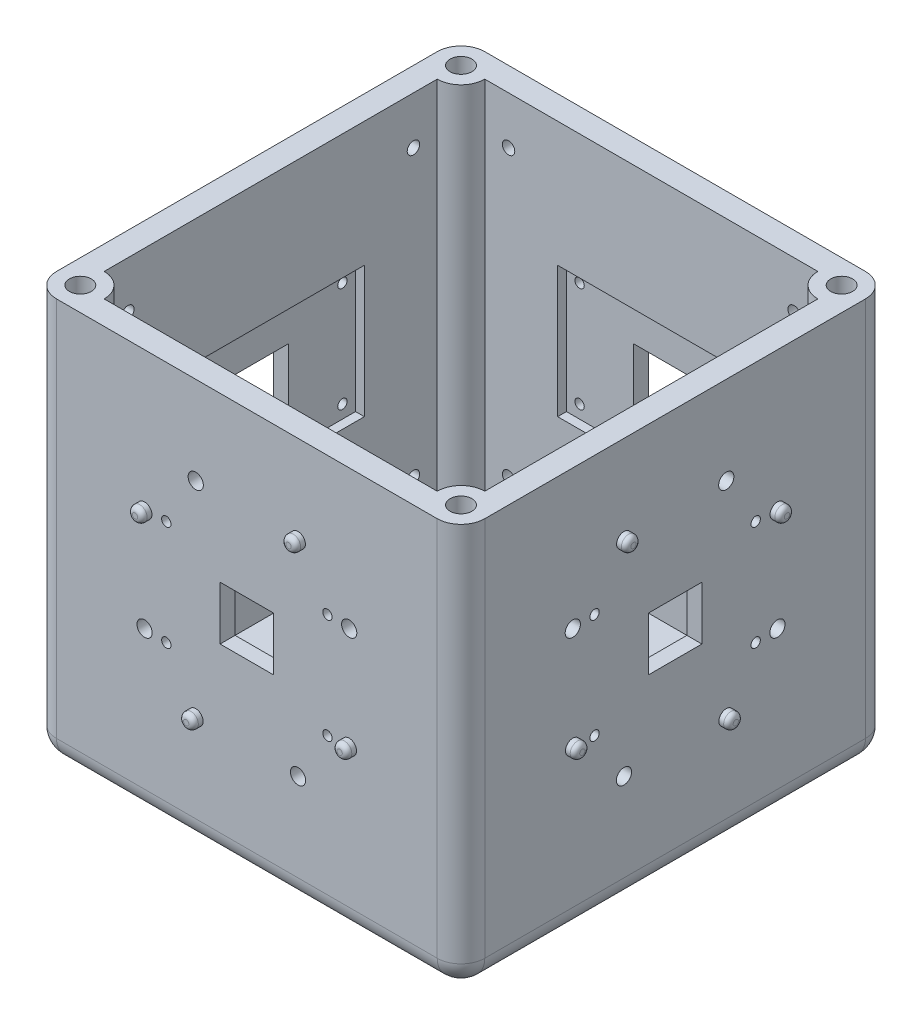
from build123d import *

# Parameters (mm, degrees)
SKETCH1_W                                  = 114.3
SKETCH1_H                                  = 114.3
BOSS_EXTRUDE1_DEPTH                        = 53.975
SHELL1_T                                   = -6.35
SKETCH3_W                                  = 6.35
SKETCH3_H                                  = 101.6
REVOLVE1_ANGLE                             = 90
MIRROR1_AT_THE_SECOND_PLANE_COPY_1_SKETC_W = 6.35
MIRROR1_AT_THE_SECOND_PLANE_COPY_1_SKETC_H = 101.6
MIRROR1_AT_THE_SECOND_PLANE_COPY_1_ANGLE   = 90
SKETCH16_W                                 = 14.2875
SKETCH16_H                                 = 14.2875
CUT_EXTRUDE1_DEPTH                         = 4
MIRROR4_AT_THE_SECOND_PLANE_COPY_1_SKETC_W = 14.2875
MIRROR4_AT_THE_SECOND_PLANE_COPY_1_SKETC_H = 14.2875
MIRROR4_AT_THE_SECOND_PLANE_COPY_1_DEPTH   = 4
FILLET1_R                                  = 6.35
SKETCH22_R                                 = 2.92
CUT_EXTRUDE5_DEPTH                         = 5.007428571
MIRROR6_AT_THE_SECOND_PLANE_COPY_1_SKETC_R = 2.92
MIRROR6_AT_THE_SECOND_PLANE_COPY_1_DEPTH   = 5.007428571
SKETCH25_R                                 = 1.9685
BOSS_EXTRUDE2_DEPTH                        = 2.54
SKETCH25_3_R                               = 2.032
CUT_EXTRUDE6_DEPTH                         = 3.048
FILLET5_R                                  = 1.27
MIRROR14_AT_THE_SECOND_PLANE_COPY_1_SKET_R = 2.032
MIRROR14_AT_THE_SECOND_PLANE_COPY_1_DEPTH  = 3.048
SKETCH15_W                                 = 50
SKETCH15_H                                 = 35
CUT_EXTRUDE10_DEPTH                        = 2.35
CUT_EXTRUDE11_REACH                        = 143.872
MIRROR15_AT_THE_SECOND_PLANE_COPY_1_SKET_W = 50
MIRROR15_AT_THE_SECOND_PLANE_COPY_1_SKET_H = 35
MIRROR15_AT_THE_SECOND_PLANE_COPY_1_DEPTH  = 2.35
MIRROR15_AT_THE_SECOND_PLANE_COPY_2_REACH  = 143.872
CUT_EXTRUDE12_DEPTH                        = 3.302
MIRROR16_AT_THE_SECOND_PLANE_COPY_1_DEPTH  = 3.302


# Read off the part's stored shape, not the designer's step: Mirror13
with BuildPart() as part:
    # Sketch1 → Boss-Extrude1 (new, symmetric)
    with BuildSketch(Plane(origin=(0, 0, 0), x_dir=(1, 0, 0), z_dir=(0, 1, 0))):
        Rectangle(SKETCH1_W, SKETCH1_H)
    extrude(amount=BOSS_EXTRUDE1_DEPTH, both=True)

    # Shell1
    shell1_openings = [part.faces().sort_by_distance(p)[0] for p in [
        (0, 53.975, 0),
    ]]
    offset(amount=SHELL1_T, openings=shell1_openings, kind=Kind.INTERSECTION)

    # Sketch3 → Revolve1 (revolve)
    with BuildSketch(Plane(origin=(-50.8, 0, 0), x_dir=(0, 0, -1), z_dir=(1, 0, 0))):
        with Locations((-47.625, 3.175)):
            Rectangle(SKETCH3_W, SKETCH3_H)
    revolve1 = revolve(axis=Axis((-50.8, 53.975, 50.8), (0, -1, 0)), revolution_arc=REVOLVE1_ANGLE)

    # Mirror1: Revolve1 across plane
    add(revolve1.mirror(Plane(origin=(0, 0, 0), x_dir=(0, 0, 1), z_dir=(1, 0, 0))))

    # Mirror1 at the second plane: Revolve1 across plane
    add(revolve1.mirror(Plane.XY))

    # Mirror1 at the second plane copy 1 sketc → Mirror1 at the second plane copy 1 (revolve)
    with BuildSketch(Plane.ZY.offset(-50.8)):
        with Locations((-47.625, 3.175)):
            Rectangle(MIRROR1_AT_THE_SECOND_PLANE_COPY_1_SKETC_W, MIRROR1_AT_THE_SECOND_PLANE_COPY_1_SKETC_H)
    revolve(axis=Axis((50.8, 53.975, -50.8), (0, -1, 0)), revolution_arc=MIRROR1_AT_THE_SECOND_PLANE_COPY_1_ANGLE)

    # Sketch16 → Cut-Extrude1 (cut)
    with BuildSketch(Plane.ZY.offset(57.15)):
        with Locations((0, 3.175)):
            Rectangle(SKETCH16_W, SKETCH16_H)
    cut_extrude1 = extrude(amount=-CUT_EXTRUDE1_DEPTH, mode=Mode.SUBTRACT)

    # Mirror4: Cut-Extrude1 across plane
    add(cut_extrude1.mirror(Plane(origin=(0, 0, 0), x_dir=(0.7071067811865465, 0, 0.7071067811865486), z_dir=(-0.7071067811865488, 0, 0.7071067811865464))), mode=Mode.SUBTRACT)

    # Mirror4 at the second plane: Cut-Extrude1 across plane
    add(cut_extrude1.mirror(Plane(origin=(0, 0, 0), x_dir=(-0.7071067811865465, 0, 0.7071067811865486), z_dir=(0.7071067811865488, 0, 0.7071067811865464))), mode=Mode.SUBTRACT)

    # Mirror4 at the second plane copy 1 sketc → Mirror4 at the second plane copy 1 (cut)
    with BuildSketch(Plane(origin=(57.15, 0, 0), x_dir=(0, 0, -1), z_dir=(1, 0, 0))):
        with Locations((0, 3.175)):
            Rectangle(MIRROR4_AT_THE_SECOND_PLANE_COPY_1_SKETC_W, MIRROR4_AT_THE_SECOND_PLANE_COPY_1_SKETC_H)
    extrude(amount=-MIRROR4_AT_THE_SECOND_PLANE_COPY_1_DEPTH, mode=Mode.SUBTRACT)

    # Fillet1
    fillet1_edges = [part.edges().sort_by_distance(p)[0] for p in [
        (0, -53.975, -57.15),
        (57.15, -53.975, 0),
        (0, -53.975, 57.15),
        (-57.15, -53.975, 0),
        (-57.15, 0, -57.15),
        (57.15, 0, -57.15),
        (57.15, 0, 57.15),
        (-57.15, 0, 57.15),
    ]]
    fillet(fillet1_edges, radius=FILLET1_R)

    # Sketch22 → Cut-Extrude5 (cut)
    with BuildSketch(Plane(origin=(0, 53.975, 0), x_dir=(1, 0, 0), z_dir=(0, 1, 0))):
        with Locations(Location((-50.8, -50.8, 0), (0, 0, 270))):
            Circle(SKETCH22_R)
    cut_extrude5 = extrude(amount=-CUT_EXTRUDE5_DEPTH, mode=Mode.SUBTRACT)

    # Mirror6: Cut-Extrude5 across plane
    add(cut_extrude5.mirror(Plane.XY), mode=Mode.SUBTRACT)

    # Mirror6 at the second plane: Cut-Extrude5 across plane
    add(cut_extrude5.mirror(Plane(origin=(0, 0, 0), x_dir=(0, 0, 1), z_dir=(1, 0, 0))), mode=Mode.SUBTRACT)

    # Mirror6 at the second plane copy 1 sketc → Mirror6 at the second plane copy 1 (cut)
    with BuildSketch(Plane(origin=(0, 53.975, 0), x_dir=(-1, 0, 0), z_dir=(0, 1, 0))):
        with Locations(Location((-50.8, -50.8, 0), (0, 0, 270))):
            Circle(MIRROR6_AT_THE_SECOND_PLANE_COPY_1_SKETC_R)
    extrude(amount=-MIRROR6_AT_THE_SECOND_PLANE_COPY_1_DEPTH, mode=Mode.SUBTRACT)

    # Sketch25 → Boss-Extrude2 (add)
    with BuildSketch(Plane.XY.offset(57.15)):
        with Locations(Location((-27.305, 16.8275, 0), (0, 0, 180))):
            Circle(SKETCH25_R)
        with Locations(Location((13.6525, 30.48, 0), (0, 0, 180))):
            Circle(SKETCH25_R)
        with Locations(Location((27.305, -10.4775, 0), (0, 0, 180))):
            Circle(SKETCH25_R)
        with Locations(Location((-13.6525, -24.13, 0), (0, 0, 180))):
            Circle(SKETCH25_R)
    extrude(amount=BOSS_EXTRUDE2_DEPTH)

    # Sketch25<3> → Cut-Extrude6 (cut)
    with BuildSketch(Plane.XY.offset(57.15)):
        with Locations((-27.305, -10.4775)):
            Circle(SKETCH25_3_R)
        with Locations((-13.6525, 30.48)):
            Circle(SKETCH25_3_R)
        with Locations((27.305, 16.8275)):
            Circle(SKETCH25_3_R)
        with Locations((13.6525, -24.13)):
            Circle(SKETCH25_3_R)
    cut_extrude6 = extrude(amount=-CUT_EXTRUDE6_DEPTH, mode=Mode.SUBTRACT)

    # Fillet5
    fillet5_edges = [part.edges().sort_by_distance(p)[0] for p in [
        (15.621, 30.48, 59.69),
        (29.2735, -10.4775, 59.69),
        (-11.684, -24.13, 59.69),
        (-25.3365, 16.8275, 59.69),
    ]]
    fillet(fillet5_edges, radius=FILLET5_R)

    # Mirror13 outline → Mirror13 (revolve)
    with BuildSketch(Plane(origin=(0, -24.13, 13.6525), x_dir=(0, 1, 0), z_dir=(0, 0, -1))):
        with BuildLine():
            ThreePointArc((0.6985, -59.69), (1.596525612, -59.318025612), (1.9685, -58.42))
            Line((1.9685, -58.42), (1.9685, -57.15))
            Line((1.9685, -57.15), (0, -57.15))
            Line((0, -57.15), (0, -59.69))
            Line((0, -59.69), (0.6985, -59.69))
        make_face()
    revolve(axis=Axis((0, -24.13, 13.6525), (1, 0, 0)))

    # Mirror13 2 outline → Mirror13 2 (revolve)
    with BuildSketch(Plane(origin=(0, -10.4775, -27.305), x_dir=(0, 1, 0), z_dir=(0, 0, -1))):
        with BuildLine():
            Line((0, -57.15), (0, -59.69))
            Line((0, -59.69), (0.6985, -59.69))
            ThreePointArc((0.6985, -59.69), (1.596525612, -59.318025612), (1.9685, -58.42))
            Line((1.9685, -58.42), (1.9685, -57.15))
            Line((1.9685, -57.15), (0, -57.15))
        make_face()
    revolve(axis=Axis((0, -10.4775, -27.305), (1, 0, 0)))

    # Mirror13 3 outline → Mirror13 3 (revolve)
    with BuildSketch(Plane(origin=(0, 30.48, -13.6525), x_dir=(0, 1, 0), z_dir=(0, 0, -1))):
        with BuildLine():
            Line((0, -57.15), (0, -59.69))
            Line((0, -59.69), (0.6985, -59.69))
            ThreePointArc((0.6985, -59.69), (1.596525612, -59.318025612), (1.9685, -58.42))
            Line((1.9685, -58.42), (1.9685, -57.15))
            Line((1.9685, -57.15), (0, -57.15))
        make_face()
    revolve(axis=Axis((0, 30.48, -13.6525), (1, 0, 0)))

    # Mirror13 4 outline → Mirror13 4 (revolve)
    with BuildSketch(Plane(origin=(0, 16.8275, 27.305), x_dir=(0, 1, 0), z_dir=(0, 0, -1))):
        with BuildLine():
            Line((0, -57.15), (0, -59.69))
            Line((0, -59.69), (0.6985, -59.69))
            ThreePointArc((0.6985, -59.69), (1.596525612, -59.318025612), (1.9685, -58.42))
            Line((1.9685, -58.42), (1.9685, -57.15))
            Line((1.9685, -57.15), (0, -57.15))
        make_face()
    revolve(axis=Axis((0, 16.8275, 27.305), (1, 0, 0)))

    # Mirror13 5 outline → Mirror13 5 (revolve)
    with BuildSketch(Plane(origin=(0, -24.13, -13.6525), x_dir=(0, 1, 0), z_dir=(0, 0, -1))):
        with BuildLine():
            Line((1.9685, 57.15), (1.9685, 58.42))
            ThreePointArc((1.9685, 58.42), (1.596525612, 59.318025612), (0.6985, 59.69))
            Line((0.6985, 59.69), (0, 59.69))
            Line((0, 59.69), (0, 57.15))
            Line((0, 57.15), (1.9685, 57.15))
        make_face()
    revolve(axis=Axis((0, -24.13, -13.6525), (1, 0, 0)))

    # Mirror13 6 outline → Mirror13 6 (revolve)
    with BuildSketch(Plane(origin=(0, -10.4775, 27.305), x_dir=(0, 1, 0), z_dir=(0, 0, -1))):
        with BuildLine():
            Line((0.6985, 59.69), (0, 59.69))
            Line((0, 59.69), (0, 57.15))
            Line((0, 57.15), (1.9685, 57.15))
            Line((1.9685, 57.15), (1.9685, 58.42))
            ThreePointArc((1.9685, 58.42), (1.596525612, 59.318025612), (0.6985, 59.69))
        make_face()
    revolve(axis=Axis((0, -10.4775, 27.305), (1, 0, 0)))

    # Mirror13 7 outline → Mirror13 7 (revolve)
    with BuildSketch(Plane(origin=(0, 30.48, 13.6525), x_dir=(0, 1, 0), z_dir=(0, 0, -1))):
        with BuildLine():
            Line((0.6985, 59.69), (0, 59.69))
            Line((0, 59.69), (0, 57.15))
            Line((0, 57.15), (1.9685, 57.15))
            Line((1.9685, 57.15), (1.9685, 58.42))
            ThreePointArc((1.9685, 58.42), (1.596525612, 59.318025612), (0.6985, 59.69))
        make_face()
    revolve(axis=Axis((0, 30.48, 13.6525), (1, 0, 0)))

    # Mirror13 8 outline → Mirror13 8 (revolve)
    with BuildSketch(Plane(origin=(0, 16.8275, -27.305), x_dir=(0, 1, 0), z_dir=(0, 0, -1))):
        with BuildLine():
            Line((0.6985, 59.69), (0, 59.69))
            Line((0, 59.69), (0, 57.15))
            Line((0, 57.15), (1.9685, 57.15))
            Line((1.9685, 57.15), (1.9685, 58.42))
            ThreePointArc((1.9685, 58.42), (1.596525612, 59.318025612), (0.6985, 59.69))
        make_face()
    revolve(axis=Axis((0, 16.8275, -27.305), (1, 0, 0)))

    # Mirror13 9 outline → Mirror13 9 (revolve)
    with BuildSketch(Plane(origin=(13.6525, -24.13, 0), x_dir=(1, 0, 0), z_dir=(0, -1, 0))):
        with BuildLine():
            ThreePointArc((0.6985, -59.69), (1.596525612, -59.318025612), (1.9685, -58.42))
            Line((1.9685, -58.42), (1.9685, -57.15))
            Line((1.9685, -57.15), (0, -57.15))
            Line((0, -57.15), (0, -59.69))
            Line((0, -59.69), (0.6985, -59.69))
        make_face()
    revolve(axis=Axis((13.6525, -24.13, 0), (0, 0, 1)))

    # Mirror13 10 outline → Mirror13 10 (revolve)
    with BuildSketch(Plane(origin=(-27.305, -10.4775, 0), x_dir=(1, 0, 0), z_dir=(0, -1, 0))):
        with BuildLine():
            Line((0, -57.15), (0, -59.69))
            Line((0, -59.69), (0.6985, -59.69))
            ThreePointArc((0.6985, -59.69), (1.596525612, -59.318025612), (1.9685, -58.42))
            Line((1.9685, -58.42), (1.9685, -57.15))
            Line((1.9685, -57.15), (0, -57.15))
        make_face()
    revolve(axis=Axis((-27.305, -10.4775, 0), (0, 0, 1)))

    # Mirror13 11 outline → Mirror13 11 (revolve)
    with BuildSketch(Plane(origin=(-13.6525, 30.48, 0), x_dir=(1, 0, 0), z_dir=(0, -1, 0))):
        with BuildLine():
            Line((0, -57.15), (0, -59.69))
            Line((0, -59.69), (0.6985, -59.69))
            ThreePointArc((0.6985, -59.69), (1.596525612, -59.318025612), (1.9685, -58.42))
            Line((1.9685, -58.42), (1.9685, -57.15))
            Line((1.9685, -57.15), (0, -57.15))
        make_face()
    revolve(axis=Axis((-13.6525, 30.48, 0), (0, 0, 1)))

    # Mirror13 12 outline → Mirror13 12 (revolve)
    with BuildSketch(Plane(origin=(27.305, 16.8275, 0), x_dir=(1, 0, 0), z_dir=(0, -1, 0))):
        with BuildLine():
            Line((0, -57.15), (0, -59.69))
            Line((0, -59.69), (0.6985, -59.69))
            ThreePointArc((0.6985, -59.69), (1.596525612, -59.318025612), (1.9685, -58.42))
            Line((1.9685, -58.42), (1.9685, -57.15))
            Line((1.9685, -57.15), (0, -57.15))
        make_face()
    revolve(axis=Axis((27.305, 16.8275, 0), (0, 0, 1)))

    # Mirror14: Cut-Extrude6 across plane
    add(cut_extrude6.mirror(Plane(origin=(0, 0, 0), x_dir=(0.7071067811865465, 0, 0.7071067811865486), z_dir=(-0.7071067811865488, 0, 0.7071067811865464))), mode=Mode.SUBTRACT)

    # Mirror14 at the second plane: Cut-Extrude6 across plane
    add(cut_extrude6.mirror(Plane(origin=(0, 0, 0), x_dir=(-0.7071067811865465, 0, 0.7071067811865486), z_dir=(0.7071067811865488, 0, 0.7071067811865464))), mode=Mode.SUBTRACT)

    # Mirror14 at the second plane copy 1 sket → Mirror14 at the second plane copy 1 (cut)
    with BuildSketch(Plane(origin=(0, 0, -57.15), x_dir=(-1, 0, 0), z_dir=(0, 0, -1))):
        with Locations((-27.305, -10.4775)):
            Circle(MIRROR14_AT_THE_SECOND_PLANE_COPY_1_SKET_R)
        with Locations((-13.6525, 30.48)):
            Circle(MIRROR14_AT_THE_SECOND_PLANE_COPY_1_SKET_R)
        with Locations((27.305, 16.8275)):
            Circle(MIRROR14_AT_THE_SECOND_PLANE_COPY_1_SKET_R)
        with Locations((13.6525, -24.13)):
            Circle(MIRROR14_AT_THE_SECOND_PLANE_COPY_1_SKET_R)
    extrude(amount=-MIRROR14_AT_THE_SECOND_PLANE_COPY_1_DEPTH, mode=Mode.SUBTRACT)

    # Sketch15 → Cut-Extrude10 (cut)
    with BuildSketch(Plane(origin=(-50.8, 0, 0), x_dir=(0, 0, -1), z_dir=(1, 0, 0))):
        with Locations((0, 3.175)):
            Rectangle(SKETCH15_W, SKETCH15_H)
    cut_extrude10 = extrude(amount=-CUT_EXTRUDE10_DEPTH, mode=Mode.SUBTRACT)

    # Sketch34 → Cut-Extrude11 (cut, up to next)
    with BuildSketch(Plane.ZY.offset(57.15), mode=Mode.PRIVATE) as cut_extrude11_sk1:
        with BuildLine():
            Line((-21.5, 15.925), (-21.5, 17.175))
            Line((-21.5, 17.175), (-20.25, 17.175))
            ThreePointArc((-20.25, 17.175), (-22.383883476, 18.058883476), (-21.5, 15.925))
        make_face()
    cut_extrude11_tool1 = extrude(cut_extrude11_sk1.sketch, amount=-CUT_EXTRUDE11_REACH, mode=Mode.PRIVATE) & part.part
    # Sketch34 → Cut-Extrude11 (cut, up to next)
    with BuildSketch(Plane.ZY.offset(57.15), mode=Mode.PRIVATE) as cut_extrude11_sk2:
        with BuildLine():
            Line((-20.25, 17.175), (-21.5, 17.175))
            Line((-21.5, 17.175), (-21.5, 15.925))
            ThreePointArc((-21.5, 15.925), (-20.616116524, 16.291116524), (-20.25, 17.175))
        make_face()
    cut_extrude11_tool2 = extrude(cut_extrude11_sk2.sketch, amount=-CUT_EXTRUDE11_REACH, mode=Mode.PRIVATE) & part.part
    # Sketch34 → Cut-Extrude11 (cut, up to next)
    with BuildSketch(Plane.ZY.offset(57.15), mode=Mode.PRIVATE) as cut_extrude11_sk3:
        with BuildLine():
            Line((-21.5, 15.925), (-21.5, 17.175))
            Line((-21.5, 17.175), (-20.25, 17.175))
            ThreePointArc((-20.25, 17.175), (-22.383883476, 18.058883476), (-21.5, 15.925))
        make_face()
    cut_extrude11_tool3 = extrude(cut_extrude11_sk3.sketch, amount=-CUT_EXTRUDE11_REACH, mode=Mode.PRIVATE) & part.part
    # Sketch34 → Cut-Extrude11 (cut, up to next)
    with BuildSketch(Plane.ZY.offset(57.15), mode=Mode.PRIVATE) as cut_extrude11_sk4:
        with BuildLine():
            Line((-20.25, 17.175), (-21.5, 17.175))
            Line((-21.5, 17.175), (-21.5, 15.925))
            ThreePointArc((-21.5, 15.925), (-20.616116524, 16.291116524), (-20.25, 17.175))
        make_face()
    cut_extrude11_tool4 = extrude(cut_extrude11_sk4.sketch, amount=-CUT_EXTRUDE11_REACH, mode=Mode.PRIVATE) & part.part
    # Sketch34 → Cut-Extrude11 (cut, up to next)
    with BuildSketch(Plane.ZY.offset(57.15), mode=Mode.PRIVATE) as cut_extrude11_sk5:
        with BuildLine():
            ThreePointArc((22.75, 17.175), (21.5, 18.425), (20.25, 17.175))
            Line((20.25, 17.175), (21.5, 17.175))
            Line((21.5, 17.175), (21.5, 15.925))
            ThreePointArc((21.5, 15.925), (22.383883476, 16.291116524), (22.75, 17.175))
        make_face()
    cut_extrude11_tool5 = extrude(cut_extrude11_sk5.sketch, amount=-CUT_EXTRUDE11_REACH, mode=Mode.PRIVATE) & part.part
    # Sketch34 → Cut-Extrude11 (cut, up to next)
    with BuildSketch(Plane.ZY.offset(57.15), mode=Mode.PRIVATE) as cut_extrude11_sk6:
        with BuildLine():
            Line((21.5, 17.175), (20.25, 17.175))
            ThreePointArc((20.25, 17.175), (20.616116524, 16.291116524), (21.5, 15.925))
            Line((21.5, 15.925), (21.5, 17.175))
        make_face()
    cut_extrude11_tool6 = extrude(cut_extrude11_sk6.sketch, amount=-CUT_EXTRUDE11_REACH, mode=Mode.PRIVATE) & part.part
    # Sketch34 → Cut-Extrude11 (cut, up to next)
    with BuildSketch(Plane.ZY.offset(57.15), mode=Mode.PRIVATE) as cut_extrude11_sk7:
        with BuildLine():
            ThreePointArc((22.75, 17.175), (21.5, 18.425), (20.25, 17.175))
            Line((20.25, 17.175), (21.5, 17.175))
            Line((21.5, 17.175), (21.5, 15.925))
            ThreePointArc((21.5, 15.925), (22.383883476, 16.291116524), (22.75, 17.175))
        make_face()
    cut_extrude11_tool7 = extrude(cut_extrude11_sk7.sketch, amount=-CUT_EXTRUDE11_REACH, mode=Mode.PRIVATE) & part.part
    # Sketch34 → Cut-Extrude11 (cut, up to next)
    with BuildSketch(Plane.ZY.offset(57.15), mode=Mode.PRIVATE) as cut_extrude11_sk8:
        with BuildLine():
            Line((21.5, 17.175), (20.25, 17.175))
            ThreePointArc((20.25, 17.175), (20.616116524, 16.291116524), (21.5, 15.925))
            Line((21.5, 15.925), (21.5, 17.175))
        make_face()
    cut_extrude11_tool8 = extrude(cut_extrude11_sk8.sketch, amount=-CUT_EXTRUDE11_REACH, mode=Mode.PRIVATE) & part.part
    # Sketch34 → Cut-Extrude11 (cut, up to next)
    with BuildSketch(Plane.ZY.offset(57.15), mode=Mode.PRIVATE) as cut_extrude11_sk9:
        with BuildLine():
            ThreePointArc((22.75, -10.825), (22.383883476, -9.941116524), (21.5, -9.575))
            Line((21.5, -9.575), (21.5, -10.825))
            Line((21.5, -10.825), (20.25, -10.825))
            ThreePointArc((20.25, -10.825), (21.5, -12.075), (22.75, -10.825))
        make_face()
    cut_extrude11_tool9 = extrude(cut_extrude11_sk9.sketch, amount=-CUT_EXTRUDE11_REACH, mode=Mode.PRIVATE) & part.part
    # Sketch34 → Cut-Extrude11 (cut, up to next)
    with BuildSketch(Plane.ZY.offset(57.15), mode=Mode.PRIVATE) as cut_extrude11_sk10:
        with BuildLine():
            Line((21.5, -10.825), (21.5, -9.575))
            ThreePointArc((21.5, -9.575), (20.616116524, -9.941116524), (20.25, -10.825))
            Line((20.25, -10.825), (21.5, -10.825))
        make_face()
    cut_extrude11_tool10 = extrude(cut_extrude11_sk10.sketch, amount=-CUT_EXTRUDE11_REACH, mode=Mode.PRIVATE) & part.part
    # Sketch34 → Cut-Extrude11 (cut, up to next)
    with BuildSketch(Plane.ZY.offset(57.15), mode=Mode.PRIVATE) as cut_extrude11_sk11:
        with BuildLine():
            ThreePointArc((22.75, -10.825), (22.383883476, -9.941116524), (21.5, -9.575))
            Line((21.5, -9.575), (21.5, -10.825))
            Line((21.5, -10.825), (20.25, -10.825))
            ThreePointArc((20.25, -10.825), (21.5, -12.075), (22.75, -10.825))
        make_face()
    cut_extrude11_tool11 = extrude(cut_extrude11_sk11.sketch, amount=-CUT_EXTRUDE11_REACH, mode=Mode.PRIVATE) & part.part
    # Sketch34 → Cut-Extrude11 (cut, up to next)
    with BuildSketch(Plane.ZY.offset(57.15), mode=Mode.PRIVATE) as cut_extrude11_sk12:
        with BuildLine():
            Line((21.5, -10.825), (21.5, -9.575))
            ThreePointArc((21.5, -9.575), (20.616116524, -9.941116524), (20.25, -10.825))
            Line((20.25, -10.825), (21.5, -10.825))
        make_face()
    cut_extrude11_tool12 = extrude(cut_extrude11_sk12.sketch, amount=-CUT_EXTRUDE11_REACH, mode=Mode.PRIVATE) & part.part
    # Sketch34 → Cut-Extrude11 (cut, up to next)
    with BuildSketch(Plane.ZY.offset(57.15), mode=Mode.PRIVATE) as cut_extrude11_sk13:
        with BuildLine():
            ThreePointArc((-20.25, -10.825), (-20.616116524, -9.941116524), (-21.5, -9.575))
            Line((-21.5, -9.575), (-21.5, -10.825))
            Line((-21.5, -10.825), (-20.25, -10.825))
        make_face()
    cut_extrude11_tool13 = extrude(cut_extrude11_sk13.sketch, amount=-CUT_EXTRUDE11_REACH, mode=Mode.PRIVATE) & part.part
    # Sketch34 → Cut-Extrude11 (cut, up to next)
    with BuildSketch(Plane.ZY.offset(57.15), mode=Mode.PRIVATE) as cut_extrude11_sk14:
        with BuildLine():
            Line((-21.5, -10.825), (-21.5, -9.575))
            ThreePointArc((-21.5, -9.575), (-22.383883476, -11.708883476), (-20.25, -10.825))
            Line((-20.25, -10.825), (-21.5, -10.825))
        make_face()
    cut_extrude11_tool14 = extrude(cut_extrude11_sk14.sketch, amount=-CUT_EXTRUDE11_REACH, mode=Mode.PRIVATE) & part.part
    # Sketch34 → Cut-Extrude11 (cut, up to next)
    with BuildSketch(Plane.ZY.offset(57.15), mode=Mode.PRIVATE) as cut_extrude11_sk15:
        with BuildLine():
            ThreePointArc((-20.25, -10.825), (-20.616116524, -9.941116524), (-21.5, -9.575))
            Line((-21.5, -9.575), (-21.5, -10.825))
            Line((-21.5, -10.825), (-20.25, -10.825))
        make_face()
    cut_extrude11_tool15 = extrude(cut_extrude11_sk15.sketch, amount=-CUT_EXTRUDE11_REACH, mode=Mode.PRIVATE) & part.part
    # Sketch34 → Cut-Extrude11 (cut, up to next)
    with BuildSketch(Plane.ZY.offset(57.15), mode=Mode.PRIVATE) as cut_extrude11_sk16:
        with BuildLine():
            Line((-21.5, -10.825), (-21.5, -9.575))
            ThreePointArc((-21.5, -9.575), (-22.383883476, -11.708883476), (-20.25, -10.825))
            Line((-20.25, -10.825), (-21.5, -10.825))
        make_face()
    cut_extrude11_tool16 = extrude(cut_extrude11_sk16.sketch, amount=-CUT_EXTRUDE11_REACH, mode=Mode.PRIVATE) & part.part
    cut_extrude11_1 = cut_extrude11_tool1.solids().sort_by_distance((-57.15, 17.351839, -21.676839))[0]
    add(cut_extrude11_1, mode=Mode.SUBTRACT)
    cut_extrude11_2 = cut_extrude11_tool2.solids().sort_by_distance((-57.15, 16.644484, -20.969484))[0]
    add(cut_extrude11_2, mode=Mode.SUBTRACT)
    cut_extrude11_3 = cut_extrude11_tool3.solids().sort_by_distance((-57.15, 17.351839, -21.676839))[0]
    add(cut_extrude11_3, mode=Mode.SUBTRACT)
    cut_extrude11_4 = cut_extrude11_tool4.solids().sort_by_distance((-57.15, 16.644484, -20.969484))[0]
    add(cut_extrude11_4, mode=Mode.SUBTRACT)
    cut_extrude11_5 = cut_extrude11_tool5.solids().sort_by_distance((-57.15, 17.351839, 21.676839))[0]
    add(cut_extrude11_5, mode=Mode.SUBTRACT)
    cut_extrude11_6 = cut_extrude11_tool6.solids().sort_by_distance((-57.15, 16.644484, 20.969484))[0]
    add(cut_extrude11_6, mode=Mode.SUBTRACT)
    cut_extrude11_7 = cut_extrude11_tool7.solids().sort_by_distance((-57.15, 17.351839, 21.676839))[0]
    add(cut_extrude11_7, mode=Mode.SUBTRACT)
    cut_extrude11_8 = cut_extrude11_tool8.solids().sort_by_distance((-57.15, 16.644484, 20.969484))[0]
    add(cut_extrude11_8, mode=Mode.SUBTRACT)
    cut_extrude11_9 = cut_extrude11_tool9.solids().sort_by_distance((-57.15, -11.001839, 21.676839))[0]
    add(cut_extrude11_9, mode=Mode.SUBTRACT)
    cut_extrude11_10 = cut_extrude11_tool10.solids().sort_by_distance((-57.15, -10.294484, 20.969484))[0]
    add(cut_extrude11_10, mode=Mode.SUBTRACT)
    cut_extrude11_11 = cut_extrude11_tool11.solids().sort_by_distance((-57.15, -11.001839, 21.676839))[0]
    add(cut_extrude11_11, mode=Mode.SUBTRACT)
    cut_extrude11_12 = cut_extrude11_tool12.solids().sort_by_distance((-57.15, -10.294484, 20.969484))[0]
    add(cut_extrude11_12, mode=Mode.SUBTRACT)
    cut_extrude11_13 = cut_extrude11_tool13.solids().sort_by_distance((-57.15, -10.294484, -20.969484))[0]
    add(cut_extrude11_13, mode=Mode.SUBTRACT)
    cut_extrude11_14 = cut_extrude11_tool14.solids().sort_by_distance((-57.15, -11.001839, -21.676839))[0]
    add(cut_extrude11_14, mode=Mode.SUBTRACT)
    cut_extrude11_15 = cut_extrude11_tool15.solids().sort_by_distance((-57.15, -10.294484, -20.969484))[0]
    add(cut_extrude11_15, mode=Mode.SUBTRACT)
    cut_extrude11_16 = cut_extrude11_tool16.solids().sort_by_distance((-57.15, -11.001839, -21.676839))[0]
    add(cut_extrude11_16, mode=Mode.SUBTRACT)
    cut_extrude11 = cut_extrude11_1 + cut_extrude11_2 + cut_extrude11_3 + cut_extrude11_4 + cut_extrude11_5 + cut_extrude11_6 + cut_extrude11_7 + cut_extrude11_8 + cut_extrude11_9 + cut_extrude11_10 + cut_extrude11_11 + cut_extrude11_12 + cut_extrude11_13 + cut_extrude11_14 + cut_extrude11_15 + cut_extrude11_16  # Cut-Extrude11 as one shape, for the pattern or mirror that repeats it

    # Mirror15: Cut-Extrude10, Cut-Extrude11 across plane
    add(cut_extrude10.mirror(Plane(origin=(0, 0, 0), x_dir=(0.7071067811865465, 0, 0.7071067811865486), z_dir=(-0.7071067811865488, 0, 0.7071067811865464))), mode=Mode.SUBTRACT)
    add(cut_extrude11.mirror(Plane(origin=(0, 0, 0), x_dir=(0.7071067811865465, 0, 0.7071067811865486), z_dir=(-0.7071067811865488, 0, 0.7071067811865464))), mode=Mode.SUBTRACT)

    # Mirror15 at the second plane: Cut-Extrude10, Cut-Extrude11 across plane
    add(cut_extrude10.mirror(Plane(origin=(0, 0, 0), x_dir=(-0.7071067811865465, 0, 0.7071067811865486), z_dir=(0.7071067811865488, 0, 0.7071067811865464))), mode=Mode.SUBTRACT)
    add(cut_extrude11.mirror(Plane(origin=(0, 0, 0), x_dir=(-0.7071067811865465, 0, 0.7071067811865486), z_dir=(0.7071067811865488, 0, 0.7071067811865464))), mode=Mode.SUBTRACT)

    # Mirror15 at the second plane copy 1 sket → Mirror15 at the second plane copy 1 (cut)
    with BuildSketch(Plane.ZY.offset(-50.8)):
        with Locations((0, 3.175)):
            Rectangle(MIRROR15_AT_THE_SECOND_PLANE_COPY_1_SKET_W, MIRROR15_AT_THE_SECOND_PLANE_COPY_1_SKET_H)
    extrude(amount=-MIRROR15_AT_THE_SECOND_PLANE_COPY_1_DEPTH, mode=Mode.SUBTRACT)

    # Mirror15 at the second plane copy 2 sket → Mirror15 at the second plane copy 2 (cut, up to next)
    with BuildSketch(Plane(origin=(57.15, 0, 0), x_dir=(0, 0, -1), z_dir=(1, 0, 0)), mode=Mode.PRIVATE) as mirror15_at_the_second_plane_copy_2_sk1:
        with BuildLine():
            Line((-21.5, 15.925), (-21.5, 17.175))
            Line((-21.5, 17.175), (-20.25, 17.175))
            ThreePointArc((-20.25, 17.175), (-22.383883476, 18.058883476), (-21.5, 15.925))
        make_face()
    mirror15_at_the_second_plane_copy_2_tool1 = extrude(mirror15_at_the_second_plane_copy_2_sk1.sketch, amount=-MIRROR15_AT_THE_SECOND_PLANE_COPY_2_REACH, mode=Mode.PRIVATE) & part.part
    # Mirror15 at the second plane copy 2 sket → Mirror15 at the second plane copy 2 (cut, up to next)
    with BuildSketch(Plane(origin=(57.15, 0, 0), x_dir=(0, 0, -1), z_dir=(1, 0, 0)), mode=Mode.PRIVATE) as mirror15_at_the_second_plane_copy_2_sk2:
        with BuildLine():
            Line((-20.25, 17.175), (-21.5, 17.175))
            Line((-21.5, 17.175), (-21.5, 15.925))
            ThreePointArc((-21.5, 15.925), (-20.616116524, 16.291116524), (-20.25, 17.175))
        make_face()
    mirror15_at_the_second_plane_copy_2_tool2 = extrude(mirror15_at_the_second_plane_copy_2_sk2.sketch, amount=-MIRROR15_AT_THE_SECOND_PLANE_COPY_2_REACH, mode=Mode.PRIVATE) & part.part
    # Mirror15 at the second plane copy 2 sket → Mirror15 at the second plane copy 2 (cut, up to next)
    with BuildSketch(Plane(origin=(57.15, 0, 0), x_dir=(0, 0, -1), z_dir=(1, 0, 0)), mode=Mode.PRIVATE) as mirror15_at_the_second_plane_copy_2_sk3:
        with BuildLine():
            Line((-21.5, 15.925), (-21.5, 17.175))
            Line((-21.5, 17.175), (-20.25, 17.175))
            ThreePointArc((-20.25, 17.175), (-22.383883476, 18.058883476), (-21.5, 15.925))
        make_face()
    mirror15_at_the_second_plane_copy_2_tool3 = extrude(mirror15_at_the_second_plane_copy_2_sk3.sketch, amount=-MIRROR15_AT_THE_SECOND_PLANE_COPY_2_REACH, mode=Mode.PRIVATE) & part.part
    # Mirror15 at the second plane copy 2 sket → Mirror15 at the second plane copy 2 (cut, up to next)
    with BuildSketch(Plane(origin=(57.15, 0, 0), x_dir=(0, 0, -1), z_dir=(1, 0, 0)), mode=Mode.PRIVATE) as mirror15_at_the_second_plane_copy_2_sk4:
        with BuildLine():
            Line((-20.25, 17.175), (-21.5, 17.175))
            Line((-21.5, 17.175), (-21.5, 15.925))
            ThreePointArc((-21.5, 15.925), (-20.616116524, 16.291116524), (-20.25, 17.175))
        make_face()
    mirror15_at_the_second_plane_copy_2_tool4 = extrude(mirror15_at_the_second_plane_copy_2_sk4.sketch, amount=-MIRROR15_AT_THE_SECOND_PLANE_COPY_2_REACH, mode=Mode.PRIVATE) & part.part
    # Mirror15 at the second plane copy 2 sket → Mirror15 at the second plane copy 2 (cut, up to next)
    with BuildSketch(Plane(origin=(57.15, 0, 0), x_dir=(0, 0, -1), z_dir=(1, 0, 0)), mode=Mode.PRIVATE) as mirror15_at_the_second_plane_copy_2_sk5:
        with BuildLine():
            ThreePointArc((22.75, 17.175), (21.5, 18.425), (20.25, 17.175))
            Line((20.25, 17.175), (21.5, 17.175))
            Line((21.5, 17.175), (21.5, 15.925))
            ThreePointArc((21.5, 15.925), (22.383883476, 16.291116524), (22.75, 17.175))
        make_face()
    mirror15_at_the_second_plane_copy_2_tool5 = extrude(mirror15_at_the_second_plane_copy_2_sk5.sketch, amount=-MIRROR15_AT_THE_SECOND_PLANE_COPY_2_REACH, mode=Mode.PRIVATE) & part.part
    # Mirror15 at the second plane copy 2 sket → Mirror15 at the second plane copy 2 (cut, up to next)
    with BuildSketch(Plane(origin=(57.15, 0, 0), x_dir=(0, 0, -1), z_dir=(1, 0, 0)), mode=Mode.PRIVATE) as mirror15_at_the_second_plane_copy_2_sk6:
        with BuildLine():
            Line((21.5, 17.175), (20.25, 17.175))
            ThreePointArc((20.25, 17.175), (20.616116524, 16.291116524), (21.5, 15.925))
            Line((21.5, 15.925), (21.5, 17.175))
        make_face()
    mirror15_at_the_second_plane_copy_2_tool6 = extrude(mirror15_at_the_second_plane_copy_2_sk6.sketch, amount=-MIRROR15_AT_THE_SECOND_PLANE_COPY_2_REACH, mode=Mode.PRIVATE) & part.part
    # Mirror15 at the second plane copy 2 sket → Mirror15 at the second plane copy 2 (cut, up to next)
    with BuildSketch(Plane(origin=(57.15, 0, 0), x_dir=(0, 0, -1), z_dir=(1, 0, 0)), mode=Mode.PRIVATE) as mirror15_at_the_second_plane_copy_2_sk7:
        with BuildLine():
            ThreePointArc((22.75, 17.175), (21.5, 18.425), (20.25, 17.175))
            Line((20.25, 17.175), (21.5, 17.175))
            Line((21.5, 17.175), (21.5, 15.925))
            ThreePointArc((21.5, 15.925), (22.383883476, 16.291116524), (22.75, 17.175))
        make_face()
    mirror15_at_the_second_plane_copy_2_tool7 = extrude(mirror15_at_the_second_plane_copy_2_sk7.sketch, amount=-MIRROR15_AT_THE_SECOND_PLANE_COPY_2_REACH, mode=Mode.PRIVATE) & part.part
    # Mirror15 at the second plane copy 2 sket → Mirror15 at the second plane copy 2 (cut, up to next)
    with BuildSketch(Plane(origin=(57.15, 0, 0), x_dir=(0, 0, -1), z_dir=(1, 0, 0)), mode=Mode.PRIVATE) as mirror15_at_the_second_plane_copy_2_sk8:
        with BuildLine():
            Line((21.5, 17.175), (20.25, 17.175))
            ThreePointArc((20.25, 17.175), (20.616116524, 16.291116524), (21.5, 15.925))
            Line((21.5, 15.925), (21.5, 17.175))
        make_face()
    mirror15_at_the_second_plane_copy_2_tool8 = extrude(mirror15_at_the_second_plane_copy_2_sk8.sketch, amount=-MIRROR15_AT_THE_SECOND_PLANE_COPY_2_REACH, mode=Mode.PRIVATE) & part.part
    # Mirror15 at the second plane copy 2 sket → Mirror15 at the second plane copy 2 (cut, up to next)
    with BuildSketch(Plane(origin=(57.15, 0, 0), x_dir=(0, 0, -1), z_dir=(1, 0, 0)), mode=Mode.PRIVATE) as mirror15_at_the_second_plane_copy_2_sk9:
        with BuildLine():
            ThreePointArc((22.75, -10.825), (22.383883476, -9.941116524), (21.5, -9.575))
            Line((21.5, -9.575), (21.5, -10.825))
            Line((21.5, -10.825), (20.25, -10.825))
            ThreePointArc((20.25, -10.825), (21.5, -12.075), (22.75, -10.825))
        make_face()
    mirror15_at_the_second_plane_copy_2_tool9 = extrude(mirror15_at_the_second_plane_copy_2_sk9.sketch, amount=-MIRROR15_AT_THE_SECOND_PLANE_COPY_2_REACH, mode=Mode.PRIVATE) & part.part
    # Mirror15 at the second plane copy 2 sket → Mirror15 at the second plane copy 2 (cut, up to next)
    with BuildSketch(Plane(origin=(57.15, 0, 0), x_dir=(0, 0, -1), z_dir=(1, 0, 0)), mode=Mode.PRIVATE) as mirror15_at_the_second_plane_copy_2_sk10:
        with BuildLine():
            Line((21.5, -10.825), (21.5, -9.575))
            ThreePointArc((21.5, -9.575), (20.616116524, -9.941116524), (20.25, -10.825))
            Line((20.25, -10.825), (21.5, -10.825))
        make_face()
    mirror15_at_the_second_plane_copy_2_tool10 = extrude(mirror15_at_the_second_plane_copy_2_sk10.sketch, amount=-MIRROR15_AT_THE_SECOND_PLANE_COPY_2_REACH, mode=Mode.PRIVATE) & part.part
    # Mirror15 at the second plane copy 2 sket → Mirror15 at the second plane copy 2 (cut, up to next)
    with BuildSketch(Plane(origin=(57.15, 0, 0), x_dir=(0, 0, -1), z_dir=(1, 0, 0)), mode=Mode.PRIVATE) as mirror15_at_the_second_plane_copy_2_sk11:
        with BuildLine():
            ThreePointArc((22.75, -10.825), (22.383883476, -9.941116524), (21.5, -9.575))
            Line((21.5, -9.575), (21.5, -10.825))
            Line((21.5, -10.825), (20.25, -10.825))
            ThreePointArc((20.25, -10.825), (21.5, -12.075), (22.75, -10.825))
        make_face()
    mirror15_at_the_second_plane_copy_2_tool11 = extrude(mirror15_at_the_second_plane_copy_2_sk11.sketch, amount=-MIRROR15_AT_THE_SECOND_PLANE_COPY_2_REACH, mode=Mode.PRIVATE) & part.part
    # Mirror15 at the second plane copy 2 sket → Mirror15 at the second plane copy 2 (cut, up to next)
    with BuildSketch(Plane(origin=(57.15, 0, 0), x_dir=(0, 0, -1), z_dir=(1, 0, 0)), mode=Mode.PRIVATE) as mirror15_at_the_second_plane_copy_2_sk12:
        with BuildLine():
            Line((21.5, -10.825), (21.5, -9.575))
            ThreePointArc((21.5, -9.575), (20.616116524, -9.941116524), (20.25, -10.825))
            Line((20.25, -10.825), (21.5, -10.825))
        make_face()
    mirror15_at_the_second_plane_copy_2_tool12 = extrude(mirror15_at_the_second_plane_copy_2_sk12.sketch, amount=-MIRROR15_AT_THE_SECOND_PLANE_COPY_2_REACH, mode=Mode.PRIVATE) & part.part
    # Mirror15 at the second plane copy 2 sket → Mirror15 at the second plane copy 2 (cut, up to next)
    with BuildSketch(Plane(origin=(57.15, 0, 0), x_dir=(0, 0, -1), z_dir=(1, 0, 0)), mode=Mode.PRIVATE) as mirror15_at_the_second_plane_copy_2_sk13:
        with BuildLine():
            ThreePointArc((-20.25, -10.825), (-20.616116524, -9.941116524), (-21.5, -9.575))
            Line((-21.5, -9.575), (-21.5, -10.825))
            Line((-21.5, -10.825), (-20.25, -10.825))
        make_face()
    mirror15_at_the_second_plane_copy_2_tool13 = extrude(mirror15_at_the_second_plane_copy_2_sk13.sketch, amount=-MIRROR15_AT_THE_SECOND_PLANE_COPY_2_REACH, mode=Mode.PRIVATE) & part.part
    # Mirror15 at the second plane copy 2 sket → Mirror15 at the second plane copy 2 (cut, up to next)
    with BuildSketch(Plane(origin=(57.15, 0, 0), x_dir=(0, 0, -1), z_dir=(1, 0, 0)), mode=Mode.PRIVATE) as mirror15_at_the_second_plane_copy_2_sk14:
        with BuildLine():
            Line((-21.5, -10.825), (-21.5, -9.575))
            ThreePointArc((-21.5, -9.575), (-22.383883476, -11.708883476), (-20.25, -10.825))
            Line((-20.25, -10.825), (-21.5, -10.825))
        make_face()
    mirror15_at_the_second_plane_copy_2_tool14 = extrude(mirror15_at_the_second_plane_copy_2_sk14.sketch, amount=-MIRROR15_AT_THE_SECOND_PLANE_COPY_2_REACH, mode=Mode.PRIVATE) & part.part
    # Mirror15 at the second plane copy 2 sket → Mirror15 at the second plane copy 2 (cut, up to next)
    with BuildSketch(Plane(origin=(57.15, 0, 0), x_dir=(0, 0, -1), z_dir=(1, 0, 0)), mode=Mode.PRIVATE) as mirror15_at_the_second_plane_copy_2_sk15:
        with BuildLine():
            ThreePointArc((-20.25, -10.825), (-20.616116524, -9.941116524), (-21.5, -9.575))
            Line((-21.5, -9.575), (-21.5, -10.825))
            Line((-21.5, -10.825), (-20.25, -10.825))
        make_face()
    mirror15_at_the_second_plane_copy_2_tool15 = extrude(mirror15_at_the_second_plane_copy_2_sk15.sketch, amount=-MIRROR15_AT_THE_SECOND_PLANE_COPY_2_REACH, mode=Mode.PRIVATE) & part.part
    # Mirror15 at the second plane copy 2 sket → Mirror15 at the second plane copy 2 (cut, up to next)
    with BuildSketch(Plane(origin=(57.15, 0, 0), x_dir=(0, 0, -1), z_dir=(1, 0, 0)), mode=Mode.PRIVATE) as mirror15_at_the_second_plane_copy_2_sk16:
        with BuildLine():
            Line((-21.5, -10.825), (-21.5, -9.575))
            ThreePointArc((-21.5, -9.575), (-22.383883476, -11.708883476), (-20.25, -10.825))
            Line((-20.25, -10.825), (-21.5, -10.825))
        make_face()
    mirror15_at_the_second_plane_copy_2_tool16 = extrude(mirror15_at_the_second_plane_copy_2_sk16.sketch, amount=-MIRROR15_AT_THE_SECOND_PLANE_COPY_2_REACH, mode=Mode.PRIVATE) & part.part
    add(mirror15_at_the_second_plane_copy_2_tool1.solids().sort_by_distance((57.15, 17.351839, 21.676839))[0], mode=Mode.SUBTRACT)
    add(mirror15_at_the_second_plane_copy_2_tool2.solids().sort_by_distance((57.15, 16.644484, 20.969484))[0], mode=Mode.SUBTRACT)
    add(mirror15_at_the_second_plane_copy_2_tool3.solids().sort_by_distance((57.15, 17.351839, 21.676839))[0], mode=Mode.SUBTRACT)
    add(mirror15_at_the_second_plane_copy_2_tool4.solids().sort_by_distance((57.15, 16.644484, 20.969484))[0], mode=Mode.SUBTRACT)
    add(mirror15_at_the_second_plane_copy_2_tool5.solids().sort_by_distance((57.15, 17.351839, -21.676839))[0], mode=Mode.SUBTRACT)
    add(mirror15_at_the_second_plane_copy_2_tool6.solids().sort_by_distance((57.15, 16.644484, -20.969484))[0], mode=Mode.SUBTRACT)
    add(mirror15_at_the_second_plane_copy_2_tool7.solids().sort_by_distance((57.15, 17.351839, -21.676839))[0], mode=Mode.SUBTRACT)
    add(mirror15_at_the_second_plane_copy_2_tool8.solids().sort_by_distance((57.15, 16.644484, -20.969484))[0], mode=Mode.SUBTRACT)
    add(mirror15_at_the_second_plane_copy_2_tool9.solids().sort_by_distance((57.15, -11.001839, -21.676839))[0], mode=Mode.SUBTRACT)
    add(mirror15_at_the_second_plane_copy_2_tool10.solids().sort_by_distance((57.15, -10.294484, -20.969484))[0], mode=Mode.SUBTRACT)
    add(mirror15_at_the_second_plane_copy_2_tool11.solids().sort_by_distance((57.15, -11.001839, -21.676839))[0], mode=Mode.SUBTRACT)
    add(mirror15_at_the_second_plane_copy_2_tool12.solids().sort_by_distance((57.15, -10.294484, -20.969484))[0], mode=Mode.SUBTRACT)
    add(mirror15_at_the_second_plane_copy_2_tool13.solids().sort_by_distance((57.15, -10.294484, 20.969484))[0], mode=Mode.SUBTRACT)
    add(mirror15_at_the_second_plane_copy_2_tool14.solids().sort_by_distance((57.15, -11.001839, 21.676839))[0], mode=Mode.SUBTRACT)
    add(mirror15_at_the_second_plane_copy_2_tool15.solids().sort_by_distance((57.15, -10.294484, 20.969484))[0], mode=Mode.SUBTRACT)
    add(mirror15_at_the_second_plane_copy_2_tool16.solids().sort_by_distance((57.15, -11.001839, 21.676839))[0], mode=Mode.SUBTRACT)

    # Sketch35 → Cut-Extrude12 (cut)
    with BuildSketch(Plane.ZY.offset(-50.8)):
        with BuildLine():
            Line((-38.1, 39.624), (-38.1, 41.275))
            Line((-38.1, 41.275), (-36.449, 41.275))
            ThreePointArc((-36.449, 41.275), (-39.267433296, 42.442433296), (-38.1, 39.624))
        make_face()
        with BuildLine():
            Line((-36.449, 41.275), (-38.1, 41.275))
            Line((-38.1, 41.275), (-38.1, 39.624))
            ThreePointArc((-38.1, 39.624), (-36.932566704, 40.107566704), (-36.449, 41.275))
        make_face()
        with BuildLine():
            ThreePointArc((39.751, 41.275), (38.1, 42.926), (36.449, 41.275))
            Line((36.449, 41.275), (38.1, 41.275))
            Line((38.1, 41.275), (38.1, 39.624))
            ThreePointArc((38.1, 39.624), (39.267433296, 40.107566704), (39.751, 41.275))
        make_face()
        with BuildLine():
            Line((38.1, 41.275), (36.449, 41.275))
            ThreePointArc((36.449, 41.275), (36.932566704, 40.107566704), (38.1, 39.624))
            Line((38.1, 39.624), (38.1, 41.275))
        make_face()
        with BuildLine():
            ThreePointArc((39.751, -34.925), (39.267433296, -33.757566704), (38.1, -33.274))
            Line((38.1, -33.274), (38.1, -34.925))
            Line((38.1, -34.925), (36.449, -34.925))
            ThreePointArc((36.449, -34.925), (38.1, -36.576), (39.751, -34.925))
        make_face()
        with BuildLine():
            Line((38.1, -34.925), (38.1, -33.274))
            ThreePointArc((38.1, -33.274), (36.932566704, -33.757566704), (36.449, -34.925))
            Line((36.449, -34.925), (38.1, -34.925))
        make_face()
        with BuildLine():
            ThreePointArc((-36.449, -34.925), (-36.932566704, -33.757566704), (-38.1, -33.274))
            Line((-38.1, -33.274), (-38.1, -34.925))
            Line((-38.1, -34.925), (-36.449, -34.925))
        make_face()
        with BuildLine():
            Line((-38.1, -34.925), (-38.1, -33.274))
            ThreePointArc((-38.1, -33.274), (-39.267433296, -36.092433296), (-36.449, -34.925))
            Line((-36.449, -34.925), (-38.1, -34.925))
        make_face()
    cut_extrude12 = extrude(amount=-CUT_EXTRUDE12_DEPTH, mode=Mode.SUBTRACT)

    # Mirror16: Cut-Extrude12 across plane
    add(cut_extrude12.mirror(Plane(origin=(0, 0, 0), x_dir=(0.7071067811865465, 0, 0.7071067811865486), z_dir=(-0.7071067811865488, 0, 0.7071067811865464))), mode=Mode.SUBTRACT)

    # Mirror16 at the second plane: Cut-Extrude12 across plane
    add(cut_extrude12.mirror(Plane(origin=(0, 0, 0), x_dir=(-0.7071067811865465, 0, 0.7071067811865486), z_dir=(0.7071067811865488, 0, 0.7071067811865464))), mode=Mode.SUBTRACT)

    # Mirror16 at the second plane copy 1 sket → Mirror16 at the second plane copy 1 (cut)
    with BuildSketch(Plane(origin=(-50.8, 0, 0), x_dir=(0, 0, -1), z_dir=(1, 0, 0))):
        with BuildLine():
            Line((-38.1, 39.624), (-38.1, 41.275))
            Line((-38.1, 41.275), (-36.449, 41.275))
            ThreePointArc((-36.449, 41.275), (-39.267433296, 42.442433296), (-38.1, 39.624))
        make_face()
        with BuildLine():
            Line((-36.449, 41.275), (-38.1, 41.275))
            Line((-38.1, 41.275), (-38.1, 39.624))
            ThreePointArc((-38.1, 39.624), (-36.932566704, 40.107566704), (-36.449, 41.275))
        make_face()
        with BuildLine():
            ThreePointArc((39.751, 41.275), (38.1, 42.926), (36.449, 41.275))
            Line((36.449, 41.275), (38.1, 41.275))
            Line((38.1, 41.275), (38.1, 39.624))
            ThreePointArc((38.1, 39.624), (39.267433296, 40.107566704), (39.751, 41.275))
        make_face()
        with BuildLine():
            Line((38.1, 41.275), (36.449, 41.275))
            ThreePointArc((36.449, 41.275), (36.932566704, 40.107566704), (38.1, 39.624))
            Line((38.1, 39.624), (38.1, 41.275))
        make_face()
        with BuildLine():
            ThreePointArc((39.751, -34.925), (39.267433296, -33.757566704), (38.1, -33.274))
            Line((38.1, -33.274), (38.1, -34.925))
            Line((38.1, -34.925), (36.449, -34.925))
            ThreePointArc((36.449, -34.925), (38.1, -36.576), (39.751, -34.925))
        make_face()
        with BuildLine():
            Line((38.1, -34.925), (38.1, -33.274))
            ThreePointArc((38.1, -33.274), (36.932566704, -33.757566704), (36.449, -34.925))
            Line((36.449, -34.925), (38.1, -34.925))
        make_face()
        with BuildLine():
            ThreePointArc((-36.449, -34.925), (-36.932566704, -33.757566704), (-38.1, -33.274))
            Line((-38.1, -33.274), (-38.1, -34.925))
            Line((-38.1, -34.925), (-36.449, -34.925))
        make_face()
        with BuildLine():
            Line((-38.1, -34.925), (-38.1, -33.274))
            ThreePointArc((-38.1, -33.274), (-39.267433296, -36.092433296), (-36.449, -34.925))
            Line((-36.449, -34.925), (-38.1, -34.925))
        make_face()
    extrude(amount=-MIRROR16_AT_THE_SECOND_PLANE_COPY_1_DEPTH, mode=Mode.SUBTRACT)


solid = part.part
